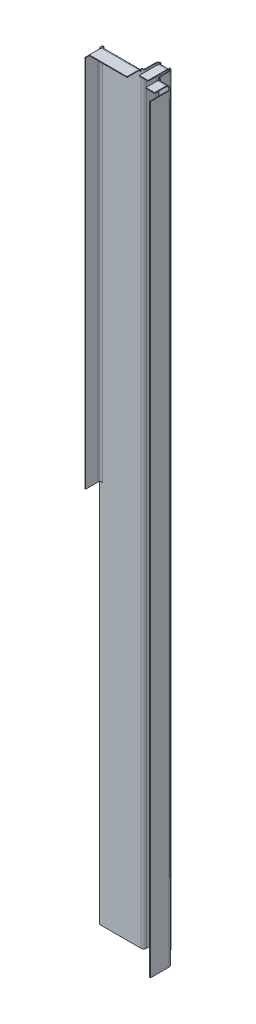
from build123d import *

# Parameters (mm, degrees)
BASE_FLANGE1_DEPTH             = 1050
CUT_EXTRUDE1_REACH             = 1056.479
EDGE_FLANGE5_STRIP_W           = 20
EDGE_FLANGE5_STRIP_H           = 1
EDGE_FLANGE5_STRIP_CUT_DEPTH   = 52
EDGE_FLANGE5_STRIP_2_W         = 20
EDGE_FLANGE5_STRIP_2_H         = 1
EDGE_FLANGE5_STRIP_CUT_2_DEPTH = 12
EDGE_FLANGE5_DEPTH             = 52
EDGE_FLANGE5_BEND_DEPTH        = 12
EDGE_FLANGE7_DEPTH             = 1046
EDGE_FLANGE8_STRIP_W           = 10
EDGE_FLANGE8_STRIP_H           = 1
EDGE_FLANGE8_STRIP_CUT_DEPTH   = 12
EDGE_FLANGE8_DEPTH             = 12
EDGE_FLANGE9_START             = 529.5
EDGE_FLANGE9_DEPTH             = 515.5
EDGE_FLANGE9_2_DEPTH           = 0.5
EDGE_FLANGE9_START_2           = 530
EDGE_FLANGE9_3_DEPTH           = 515


# Read off the part's stored shape, not the designer's step: Edge-Flange9
# Sheet-metal steps are written as plain solids
with BuildPart() as part:
    # Sketch1 → Base-Flange1 (new body)
    with BuildSketch(Plane(origin=(0, 0, 0), x_dir=(1, 0, 0), z_dir=(0, 1, 0))):
        with BuildLine():
            Line((0, 0), (-12, 0))
            ThreePointArc((-12, 0), (-14.121320344, -0.878679656), (-15, -3))
            Line((-15, -3), (-15, -16))
            ThreePointArc((-15, -16), (-16.171572875, -18.828427125), (-19, -20))
            Line((-19, -20), (-31, -20))
            ThreePointArc((-31, -20), (-33.828427125, -18.828427125), (-35, -16))
            Line((-35, -16), (-35, -3))
            ThreePointArc((-35, -3), (-35.878679656, -0.878679656), (-38, 0))
            Line((-38, 0), (-95, 0))
            Line((-95, 0), (-95, 1))
            Line((-95, 1), (-38, 1))
            ThreePointArc((-38, 1), (-35.171572875, -0.171572875), (-34, -3))
            Line((-34, -3), (-34, -16))
            ThreePointArc((-34, -16), (-33.121320344, -18.121320344), (-31, -19))
            Line((-31, -19), (-19, -19))
            ThreePointArc((-19, -19), (-16.878679656, -18.121320344), (-16, -16))
            Line((-16, -16), (-16, -3))
            ThreePointArc((-16, -3), (-14.828427125, -0.171572875), (-12, 1))
            Line((-12, 1), (0, 1))
            Line((0, 1), (0, 0))
        make_face()
    extrude(amount=BASE_FLANGE1_DEPTH)

    # Sketch18 → Cut-Extrude1 (cut, up to next)
    with BuildSketch(Plane.XY, mode=Mode.PRIVATE) as cut_extrude1_sk1:
        with BuildLine():
            Line((-95, 1045), (-95, 1050))
            Line((-95, 1050), (-90, 1050))
            ThreePointArc((-90, 1050), (-93.535533906, 1048.535533906), (-95, 1045))
        make_face()
    cut_extrude1_tool1 = extrude(cut_extrude1_sk1.sketch, amount=-CUT_EXTRUDE1_REACH, mode=Mode.PRIVATE) & part.part
    add(cut_extrude1_tool1.solids().sort_by_distance((-93.88316, 1048.88316, 0))[0], mode=Mode.SUBTRACT)

    # Edge-Flange5 strip (across the edge) → Edge-Flange5 strip cut (cut)
    with BuildSketch(Plane(origin=(-90, 1050, -1), x_dir=(0, -1, 0), z_dir=(1, 0, 0))):
        with Locations((-6, -0.5)):
            Rectangle(EDGE_FLANGE5_STRIP_W, EDGE_FLANGE5_STRIP_H)
    extrude(amount=EDGE_FLANGE5_STRIP_CUT_DEPTH, mode=Mode.SUBTRACT)

    # Edge-Flange5 strip 2 (across the edge) → Edge-Flange5 strip cut 2 (cut)
    with BuildSketch(Plane(origin=(-12, 1050, -1), x_dir=(0, -1, 0), z_dir=(1, 0, 0))):
        with Locations((-6, -0.5)):
            Rectangle(EDGE_FLANGE5_STRIP_2_W, EDGE_FLANGE5_STRIP_2_H)
    extrude(amount=EDGE_FLANGE5_STRIP_CUT_2_DEPTH, mode=Mode.SUBTRACT)

    # Edge-Flange5 section (across the edge) → Edge-Flange5 (add)
    with BuildSketch(Plane(origin=(-90, 1050, -1), x_dir=(0, -1, 0), z_dir=(1, 0, 0))):
        with BuildLine():
            Line((0, 3), (0, 19))
            Line((0, 19), (1, 19))
            Line((1, 19), (1, 3))
            ThreePointArc((1, 3), (1.878679656, 0.878679656), (4, 0))
            Line((4, 0), (4, -1))
            ThreePointArc((4, -1), (1.171572875, 0.171572875), (0, 3))
        make_face()
    extrude(amount=EDGE_FLANGE5_DEPTH)

    # Edge-Flange5 section 2 (across the edge) → Edge-Flange5 bend (add)
    with BuildSketch(Plane(origin=(-12, 1050, -1), x_dir=(0, -1, 0), z_dir=(1, 0, 0))):
        with BuildLine():
            Line((0, 3), (0, 19))
            Line((0, 19), (1, 19))
            Line((1, 19), (1, 3))
            ThreePointArc((1, 3), (1.878679656, 0.878679656), (4, 0))
            Line((4, 0), (4, -1))
            ThreePointArc((4, -1), (1.171572875, 0.171572875), (0, 3))
        make_face()
    extrude(amount=EDGE_FLANGE5_BEND_DEPTH)

    # Edge-Flange7 section (across the edge) → Edge-Flange7 (add)
    with BuildSketch(Plane(origin=(3, 1046, -1), x_dir=(-1, 0, 0), z_dir=(0, -1, 0))):
        with BuildLine():
            Line((-1, 3), (-1, 29))
            Line((-1, 29), (0, 29))
            Line((0, 29), (0, 3))
            ThreePointArc((0, 3), (0.878679656, 0.878679656), (3, 0))
            Line((3, 0), (3, -1))
            ThreePointArc((3, -1), (0.171572875, 0.171572875), (-1, 3))
        make_face()
    extrude(amount=EDGE_FLANGE7_DEPTH)

    # Edge-Flange8 strip (across the edge) → Edge-Flange8 strip cut (cut)
    with BuildSketch(Plane(origin=(-31, 1050, 19), x_dir=(0, -1, 0), z_dir=(1, 0, 0))):
        with Locations((-1, -0.5)):
            Rectangle(EDGE_FLANGE8_STRIP_W, EDGE_FLANGE8_STRIP_H)
    extrude(amount=EDGE_FLANGE8_STRIP_CUT_DEPTH, mode=Mode.SUBTRACT)

    # Edge-Flange8 section (across the edge) → Edge-Flange8 (add)
    with BuildSketch(Plane(origin=(-31, 1050, 19), x_dir=(0, -1, 0), z_dir=(1, 0, 0))):
        with BuildLine():
            Line((0, 3), (0, 29))
            Line((0, 29), (1, 29))
            Line((1, 29), (1, 3))
            ThreePointArc((1, 3), (1.878679656, 0.878679656), (4, 0))
            Line((4, 0), (4, -1))
            ThreePointArc((4, -1), (1.171572875, 0.171572875), (0, 3))
        make_face()
    extrude(amount=EDGE_FLANGE8_DEPTH)

    # Edge-Flange9 outline → Edge-Flange9 (cut)
    with BuildSketch(Plane(origin=(0, 0, 0), x_dir=(1, 0, 0), z_dir=(0, 1, 0)).offset(EDGE_FLANGE9_START)):
        with BuildLine():
            ThreePointArc((-91, 0), (-92.414213563, 0.258342613), (-93.645751312, 1))
            Line((-93.645751312, 1), (-95, 1))
            Line((-95, 1), (-95, 0))
            Line((-95, 0), (-91, 0))
        make_face()
    extrude(amount=EDGE_FLANGE9_DEPTH, mode=Mode.SUBTRACT)

    # Edge-Flange9 2 outline → Edge-Flange9 2 (cut)
    with BuildSketch(Plane(origin=(0, 0, 0), x_dir=(1, 0, 0), z_dir=(0, 1, 0)).offset(EDGE_FLANGE9_START)):
        with BuildLine():
            Line((-90.5, 1), (-93.645751312, 1))
            ThreePointArc((-93.645751312, 1), (-92.414213563, 0.258342613), (-91, 0))
            Line((-91, 0), (-90.5, 0))
            Line((-90.5, 0), (-90.5, 1))
        make_face()
    extrude(amount=EDGE_FLANGE9_2_DEPTH, mode=Mode.SUBTRACT)

    # Edge-Flange9 3 outline → Edge-Flange9 3 (add)
    with BuildSketch(Plane(origin=(0, 0, 0), x_dir=(1, 0, 0), z_dir=(0, 1, 0)).offset(EDGE_FLANGE9_START_2)):
        with BuildLine():
            Line((-95, 21), (-95, 4))
            ThreePointArc((-95, 4), (-94.645751311, 2.354248689), (-93.645751312, 1))
            Line((-93.645751312, 1), (-91, 1))
            ThreePointArc((-91, 1), (-93.121320344, 1.878679656), (-94, 4))
            Line((-94, 4), (-94, 21))
            Line((-94, 21), (-95, 21))
        make_face()
    extrude(amount=EDGE_FLANGE9_3_DEPTH)


with BuildPart() as body_2:
    # Mirror5: mirrored copy
    add(part.part.mirror(Plane.XY.offset(40)))


solid = body_2.part
